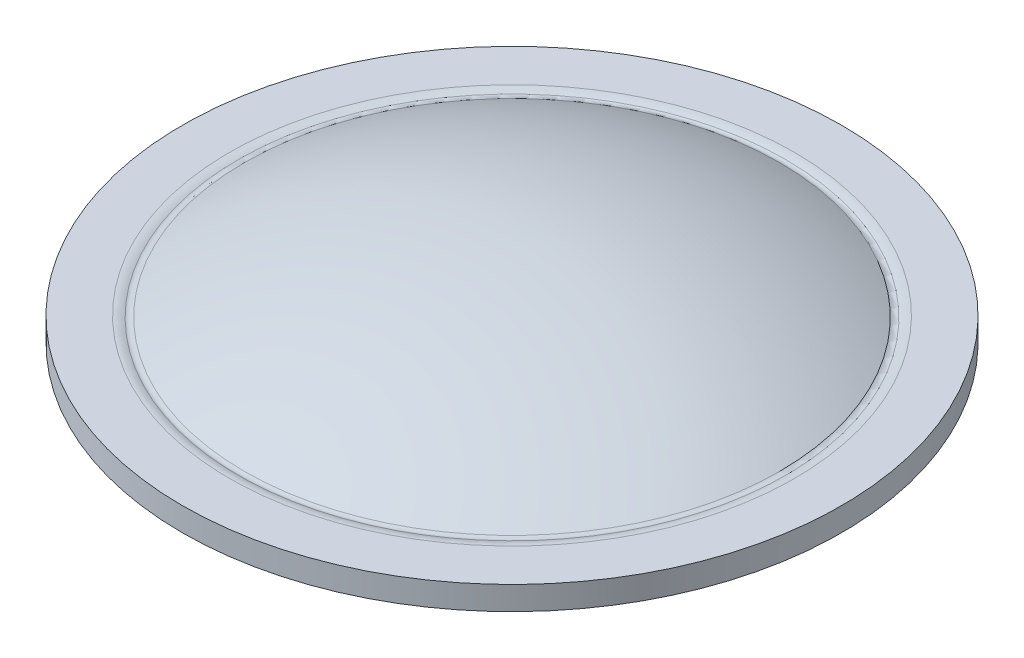
from build123d import *

# Parameters (mm, degrees)
FILLET_1_R = 0.3


# Read off the part's stored shape, not the designer's step: Оболочка1
with BuildPart() as part:
    # Эскиз1 → Повернуть1 (revolve)
    with BuildSketch(Plane.XY, mode=Mode.PRIVATE) as revolve_1_sk:
        with BuildLine():
            Line((-12, -2.866025404), (-14, -2.866025404))
            Line((-14, -2.866025404), (-14, -3.866025404))
            Line((-14, -3.866025404), (0, -3.866025404))
            Line((0, -3.866025404), (0, 0))
            ThreePointArc((0, 0), (-5.942432162, -0.762343379), (-11.5, -3))
            ThreePointArc((-11.5, -3), (-11.741180955, -2.900099577), (-12, -2.866025404))
        make_face()
    revolve(revolve_1_sk.sketch.rotate(Axis((0, -3.866025404, 0), (0, 1, 0)), 270), axis=Axis((0, -3.866025404, 0), (0, 1, 0)))

    # Оболочка1 outline → Оболочка1 (revolve, cut)
    with BuildSketch(Plane.XY):
        with BuildLine():
            Line((0, -3.866025415), (10.999812609, -3.866025415))
            ThreePointArc((10.999812609, -3.866025415), (5.683528374, -1.728270752), (0, -1))
            Line((0, -1), (0, -3.866025415))
        make_face()
    revolve(axis=Axis((0, 0, 0), (0, 1, 0)), mode=Mode.SUBTRACT)

    # Скругление1
    fillet_1_edges = [part.edges().sort_by_distance(p)[0] for p in [
        (0, -3, 11.5),
    ]]
    fillet(fillet_1_edges, radius=FILLET_1_R)


solid = part.part
